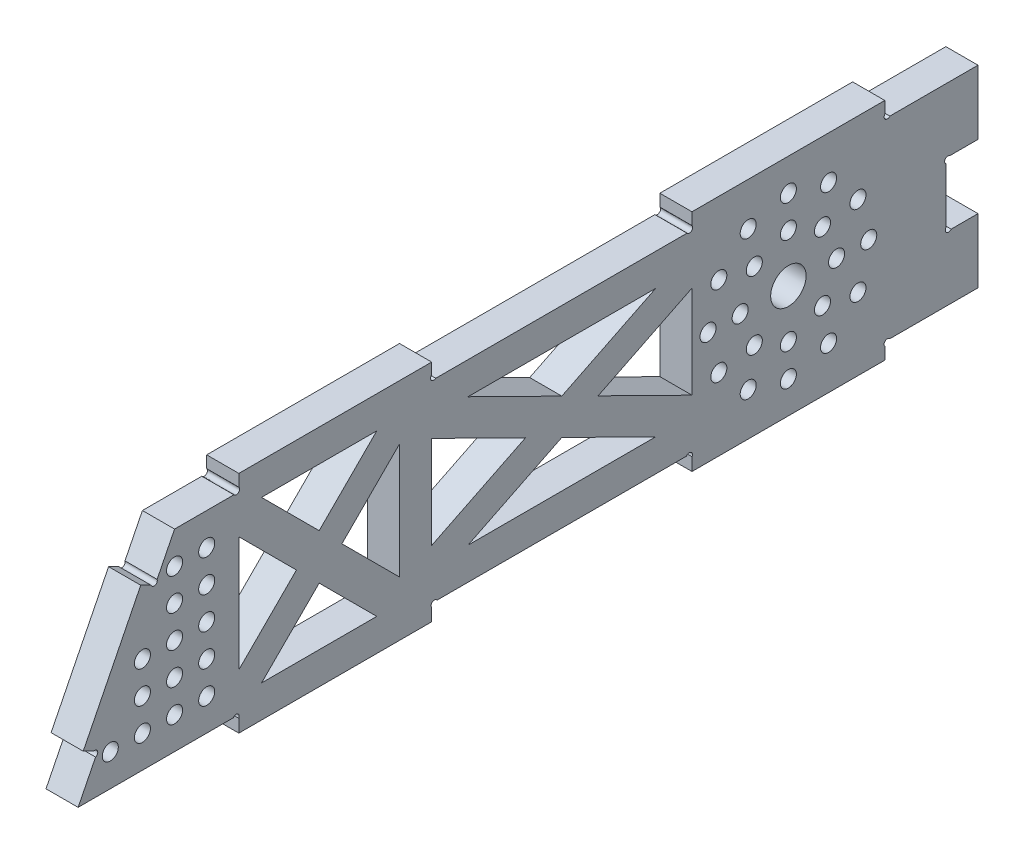
from build123d import *

# Parameters (mm, degrees)
SKETCH1_W               = 355.6
SKETCH1_H               = 76.2
BOSS_EXTRUDE1_DEPTH     = 12.7
CUT_EXTRUDE1_DEPTH      = 183.279291199
CUT_EXTRUDE1_DEPTH_BACK = 183.279291199
SKETCH3_W               = 76.2
SKETCH3_H               = 6.35
BOSS_EXTRUDE2_DEPTH     = 12.7
SKETCH4_W               = 12.7
SKETCH4_H               = 25.4
CUT_EXTRUDE2_DEPTH      = 184.711546997
SKETCH5_R               = 7
CUT_EXTRUDE3_DEPTH      = 184.711546997
CUT_EXTRUDE4_DEPTH      = 184.711546997
BOSS_EXTRUDE3_DEPTH     = 12.7
SKETCH7_R               = 3.175
CUT_EXTRUDE5_DEPTH      = 184.711546997
SKETCH9_R               = 1.27
CUT_EXTRUDE6_DEPTH      = 184.711546997


with BuildPart() as part:
    # Sketch1 → Boss-Extrude1 (new body)
    with BuildSketch(Plane(origin=(0, 0, 0), x_dir=(0, 0, -1), z_dir=(1, 0, 0))):
        Rectangle(SKETCH1_W, SKETCH1_H)
    extrude(amount=BOSS_EXTRUDE1_DEPTH)

    # Sketch2 → Cut-Extrude1 (cut, two sides: drawn at the far end of the back side and taken through both)
    with BuildSketch(Plane(origin=(12.7, 0, 0), x_dir=(0, 0, -1), z_dir=(1, 0, 0)).offset(-CUT_EXTRUDE1_DEPTH_BACK)):
        Polygon((-507.550847217, -697.601694433), (-177.8, -38.1), (-139.7, 38.1), (190.050847217, 697.601694433), (-1128.95254165, 1357.103388866), (-1826.554236083, -38.1), align=None)
    extrude(amount=CUT_EXTRUDE1_DEPTH + CUT_EXTRUDE1_DEPTH_BACK, mode=Mode.SUBTRACT)

    # Sketch3 → Boss-Extrude2 (add)
    with BuildSketch(Plane.ZY):
        with Locations((-102.87, -41.275)):
            Rectangle(SKETCH3_W, SKETCH3_H)
        with Locations((76.2, -41.275)):
            Rectangle(SKETCH3_W, SKETCH3_H)
        with Locations((-102.87, 41.275)):
            Rectangle(SKETCH3_W, SKETCH3_H)
        with Locations((76.2, 41.275)):
            Rectangle(SKETCH3_W, SKETCH3_H)
    extrude(amount=-BOSS_EXTRUDE2_DEPTH)

    # Sketch4 → Cut-Extrude2 (cut, through all)
    with BuildSketch(Plane.ZY):
        with Locations((-171.45, 0)):
            Rectangle(SKETCH4_W, SKETCH4_H)
    extrude(amount=-CUT_EXTRUDE2_DEPTH, mode=Mode.SUBTRACT)

    # Sketch5 → Cut-Extrude3 (cut, through all)
    with BuildSketch(Plane.ZY):
        with Locations((-102.87, 0)):
            Circle(SKETCH5_R)
    extrude(amount=-CUT_EXTRUDE3_DEPTH, mode=Mode.SUBTRACT)

    # Sketch6 → Cut-Extrude4 (cut, through all)
    with BuildSketch(Plane.ZY):
        Polygon((23.758802297, 25.4), (-50.428802297, 25.4), (-13.335, 7.08207294), align=None)
        Polygon((-27.676197703, 0), (-64.77, 18.31792706), (-64.77, -18.31792706), align=None)
        Polygon((38.1, -18.31792706), (38.1, 18.31792706), (1.006197703, 0), align=None)
        Polygon((-13.335, -7.08207294), (-50.428802297, -25.4), (23.758802297, -25.4), align=None)
        Polygon((105.319743879, 31.75), (59.780256121, 31.75), (82.55, 8.980256121), align=None)
        Polygon((73.569743879, 0), (50.8, 22.769743879), (50.8, -22.769743879), align=None)
        Polygon((114.3, 22.769743879), (91.530256121, 0), (114.3, -22.769743879), align=None)
        Polygon((105.319743879, -31.75), (82.55, -8.980256121), (59.780256121, -31.75), align=None)
    extrude(amount=-CUT_EXTRUDE4_DEPTH, mode=Mode.SUBTRACT)

    # Sketch8 → Boss-Extrude3 (add)
    with BuildSketch(Plane(origin=(12.7, 0, 0), x_dir=(0, 0, -1), z_dir=(1, 0, 0))):
        Polygon((-147.390774674, 22.718450651), (-170.109225326, -22.718450651), (-175.788837989, -19.87864432), (-153.070387337, 25.558256983), align=None)
    extrude(amount=-BOSS_EXTRUDE3_DEPTH)

    # Sketch7 → Cut-Extrude5 (cut, through all)
    with BuildSketch(Plane(origin=(12.7, 0, 0), x_dir=(0, 0, -1), z_dir=(1, 0, 0))):
        with Locations((121.92, 0)):
            Circle(SKETCH7_R)
        with Locations((134.62, 0)):
            Circle(SKETCH7_R)
        with Locations((116.340384182, -13.470384182)):
            Circle(SKETCH7_R)
        with Locations((102.87, -19.05)):
            Circle(SKETCH7_R)
        with Locations((89.399615818, -13.470384182)):
            Circle(SKETCH7_R)
        with Locations((83.82, 0)):
            Circle(SKETCH7_R)
        with Locations((89.399615818, 13.470384182)):
            Circle(SKETCH7_R)
        with Locations((102.87, 19.05)):
            Circle(SKETCH7_R)
        with Locations((116.340384182, 13.470384182)):
            Circle(SKETCH7_R)
        with Locations((130.36630657, -15.875)):
            Circle(SKETCH7_R)
        with Locations((118.745, -27.49630657)):
            Circle(SKETCH7_R)
        with Locations((102.87, -31.75)):
            Circle(SKETCH7_R)
        with Locations((86.995, -27.49630657)):
            Circle(SKETCH7_R)
        with Locations((75.37369343, -15.875)):
            Circle(SKETCH7_R)
        with Locations((71.12, 0)):
            Circle(SKETCH7_R)
        with Locations((75.37369343, 15.875)):
            Circle(SKETCH7_R)
        with Locations((86.995, 27.49630657)):
            Circle(SKETCH7_R)
        with Locations((102.87, 31.75)):
            Circle(SKETCH7_R)
        with Locations((118.745, 27.49630657)):
            Circle(SKETCH7_R)
        with Locations((130.36630657, 15.875)):
            Circle(SKETCH7_R)
        with Locations((-127, 25.4)):
            Circle(SKETCH7_R)
        with Locations((-127, 12.7)):
            Circle(SKETCH7_R)
        with Locations((-127, 0)):
            Circle(SKETCH7_R)
        with Locations((-127, -12.7)):
            Circle(SKETCH7_R)
        with Locations((-127, -25.4)):
            Circle(SKETCH7_R)
        with Locations((-139.7, 12.7)):
            Circle(SKETCH7_R)
        with Locations((-139.7, 0)):
            Circle(SKETCH7_R)
        with Locations((-139.7, -12.7)):
            Circle(SKETCH7_R)
        with Locations((-139.7, -25.4)):
            Circle(SKETCH7_R)
        with Locations((-152.4, 0)):
            Circle(SKETCH7_R)
        with Locations((-152.4, -12.7)):
            Circle(SKETCH7_R)
        with Locations((-152.4, -25.4)):
            Circle(SKETCH7_R)
        with Locations((-165.1, -25.4)):
            Circle(SKETCH7_R)
        with Locations((-139.7, 25.4)):
            Circle(SKETCH7_R)
    extrude(amount=-CUT_EXTRUDE5_DEPTH, mode=Mode.SUBTRACT)

    # Sketch9 → Cut-Extrude6 (cut, through all)
    with BuildSketch(Plane.ZY):
        with Locations((-165.886236233, 11.702637184)):
            Circle(SKETCH9_R)
        with Locations((-166.142391028, -11.974520196)):
            Circle(SKETCH9_R)
        with Locations((-141.972241184, 38.880008083)):
            Circle(SKETCH9_R)
        with Locations((-141.965086539, -38.889115188)):
            Circle(SKETCH9_R)
        with Locations((-63.668253289, -38.731707357)):
            Circle(SKETCH9_R)
        with Locations((-63.79159704, 38.909708372)):
            Circle(SKETCH9_R)
        with Locations((37.290762159, 39.078792172)):
            Circle(SKETCH9_R)
        with Locations((37.029396542, -38.783160476)):
            Circle(SKETCH9_R)
        with Locations((115.40280075, -38.729865466)):
            Circle(SKETCH9_R)
        with Locations((115.273134984, 38.916032048)):
            Circle(SKETCH9_R)
        with Locations((147.792383937, 23.92327844)):
            Circle(SKETCH9_R)
        with Locations((171.314053114, -23.120059914)):
            Circle(SKETCH9_R)
    extrude(amount=-CUT_EXTRUDE6_DEPTH, mode=Mode.SUBTRACT)


solid = part.part
